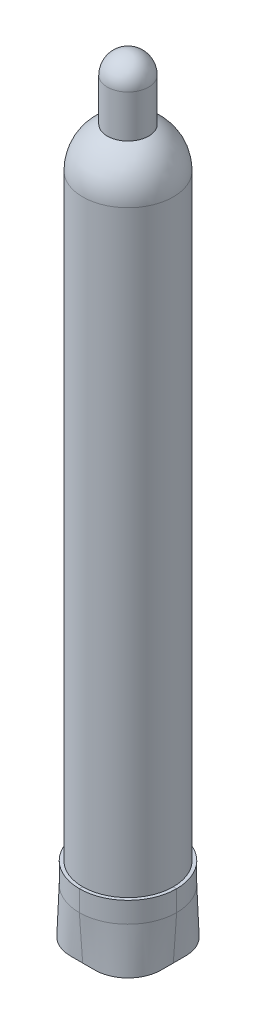
from build123d import *

# Parameters (mm, degrees)
EXTRUDE_1_DEPTH          = 50
PATTERN_CIRCULAR_2_COUNT = 4


with BuildPart() as part:
    # Эскиз1 → Повернуть1 (revolve)
    with BuildSketch(Plane.XY):
        with BuildLine():
            Line((109.5, 109.5), (109.5, 1602.582085836))
            ThreePointArc((109.5, 1602.582085836), (93.448515237, 1659.657693586), (50, 1700))
            Line((50, 1700), (50, 1802.582085836))
            ThreePointArc((50, 1802.582085836), (35.355339059, 1837.937424896), (0, 1852.582085836))
            Line((0, 1852.582085836), (0, 1843.582085836))
            ThreePointArc((0, 1843.582085836), (28.991378029, 1831.573463865), (41, 1802.582085836))
            Line((41, 1802.582085836), (41, 1694.338556998))
            ThreePointArc((41, 1694.338556998), (84.323039556, 1657.261835287), (100.5, 1602.582085836))
            Line((100.5, 1602.582085836), (100.5, 109.5))
            ThreePointArc((100.5, 109.5), (71.064231509, 38.435768491), (0, 9))
            Line((0, 9), (0, 0))
            ThreePointArc((0, 0), (77.42819254, 32.07180746), (109.5, 109.5))
        make_face()
    revolve(axis=Axis((0, -1697.886400438, 0), (0, 1, 0)))


with BuildPart() as body_2:
    # По траектории1: read off the stored shape, not the designer's step
    # По траектории1: loft between two sections, ruled curve by curve
    sweep_1_from = [
        Edge.make_bspline([(-109.5, 109.5, 0), (-109.493433422, 109.5, -0.910168025), (-109.480308312, 109.5, -2.729388887), (-109.354684179, 109.5, -5.972889138), (-109.070354228, 109.5, -10.09091356), (-108.5461644, 109.5, -14.68452027), (-107.774125544, 109.5, -19.55540512), (-106.877669566, 109.5, -23.971043834), (-105.839798954, 109.5, -28.163458896), (-104.865887775, 109.5, -31.574912227), (-103.473665348, 109.5, -35.950748157), (-101.649559756, 109.5, -40.883728987), (-99.233071788, 109.5, -46.399280964), (-97.008336197, 109.5, -50.861130938), (-94.635355215, 109.5, -55.154383025), (-92.240755866, 109.5, -59.074044109), (-88.4571369, 109.5, -64.693311466), (-83.695983566, 109.5, -70.819583859), (-76.987969909, 109.5, -78.058997048), (-70.234130613, 109.5, -84.188002557), (-63.755891418, 109.5, -89.11515306), (-58.746882418, 109.5, -92.449493446), (-54.49764908, 109.5, -95.014509627), (-50.531251362, 109.5, -97.180613295), (-45.597992341, 109.5, -99.609066967), (-40.404079053, 109.5, -101.841268541), (-35.212756467, 109.5, -103.719198527), (-31.323109565, 109.5, -104.941390476), (-27.552161282, 109.5, -106.00323483), (-23.607479605, 109.5, -106.958668933), (-18.812084881, 109.5, -107.906601335), (-14.303896069, 109.5, -108.597046997), (-9.321270503, 109.5, -109.138785516), (-5.389487063, 109.5, -109.389273408), (-2.144980996, 109.5, -109.487813496), (-0.715241188, 109.5, -109.495936426), (0, 109.5, -109.5)], [0, 0, 0, 0, 0.015603907, 0.031188696, 0.055656537, 0.086427193, 0.11063552, 0.140649137, 0.164324457, 0.185675756, 0.202477267, 0.244436193, 0.277531392, 0.307906958, 0.33185718, 0.363656198, 0.388602587, 0.451011123, 0.500000463, 0.562343923, 0.611398311, 0.643152284, 0.668143726, 0.698611393, 0.722469495, 0.764566972, 0.797523576, 0.818902887, 0.83567639, 0.865792294, 0.889365342, 0.920168946, 0.944344317, 0.975488442, 0.987737856, 1, 1, 1, 1], 3),
        Edge.make_bspline([(-117.5, 109.5, 0), (-117.492953747, 109.5, -0.97665655), (-117.478869876, 109.5, -2.928772996), (-117.344067348, 109.5, -6.409259588), (-117.038961521, 109.5, -10.828186078), (-116.476470106, 109.5, -15.757436629), (-115.648025729, 109.5, -20.984188197), (-114.68608084, 109.5, -25.722401442), (-113.572394957, 109.5, -30.221067397), (-112.527340763, 109.5, -33.881723345), (-111.033415045, 109.5, -38.577218971), (-109.076045031, 109.5, -43.870592901), (-106.482991001, 109.5, -49.789153172), (-104.095689809, 109.5, -54.57703699), (-101.549355955, 109.5, -59.183922639), (-98.979817338, 109.5, -63.389938392), (-94.919725306, 109.5, -69.419812731), (-89.810699432, 109.5, -75.993694541), (-82.612673091, 109.5, -83.761935996), (-75.3654713, 109.5, -90.338663626), (-68.413896202, 109.5, -95.625822318), (-63.03886867, 109.5, -99.203808533), (-58.479215178, 109.5, -101.95620708), (-54.223051303, 109.5, -104.280556415), (-48.929315027, 109.5, -106.886459794), (-43.355897666, 109.5, -109.281760647), (-37.785314963, 109.5, -111.296885073), (-33.611526742, 109.5, -112.608358852), (-29.565115269, 109.5, -113.747769613), (-25.332279119, 109.5, -114.772997212), (-20.186563452, 109.5, -115.790179787), (-15.349001972, 109.5, -116.531070552), (-10.002306208, 109.5, -117.112393034), (-5.78322773, 109.5, -117.381183926), (-2.30167145, 109.5, -117.486923303), (-0.767489421, 109.5, -117.495639592), (0, 109.5, -117.5)], [0, 0, 0, 0, 0.015603907, 0.031188696, 0.055656537, 0.086427193, 0.11063552, 0.140649137, 0.164324457, 0.185675756, 0.202477267, 0.244436193, 0.277531392, 0.307906958, 0.33185718, 0.363656198, 0.388602587, 0.451011123, 0.500000463, 0.562343923, 0.611398311, 0.643152284, 0.668143726, 0.698611393, 0.722469495, 0.764566972, 0.797523576, 0.818902887, 0.83567639, 0.865792294, 0.889365342, 0.920168946, 0.944344317, 0.975488442, 0.987737856, 1, 1, 1, 1], 3),
        Edge.make_line((0, 109.5, -117.5), (0, 109.5, -109.5)),
        Edge.make_line((-117.5, 109.5, 0), (-109.5, 109.5, 0)),
    ]
    sweep_1_to = [
        Edge.make_bspline([(-101.5, 0, 0), (-101.493913097, 0, -0.8436795), (-101.481746748, 0, -2.530004778), (-101.365301009, 0, -5.536518687), (-101.101746934, 0, -9.353641043), (-100.615858694, 0, -13.61160391), (-99.900225359, 0, -18.126622043), (-99.069258292, 0, -22.219686227), (-98.107202952, 0, -26.105850395), (-97.204434787, 0, -29.268101109), (-95.913915651, 0, -33.324277343), (-94.223074481, 0, -37.896865073), (-91.983152574, 0, -43.009408756), (-89.920982585, 0, -47.145224886), (-87.721354475, 0, -51.124843411), (-85.501694394, 0, -54.758149826), (-81.994548493, 0, -59.966810201), (-77.5812677, 0, -65.645473178), (-71.363266728, 0, -72.3560581), (-65.102789927, 0, -78.037341488), (-59.097886633, 0, -82.604483802), (-54.454896167, 0, -85.69517836), (-50.516082982, 0, -88.072812175), (-46.839451421, 0, -90.080670175), (-42.266669655, 0, -92.331674141), (-37.452260439, 0, -94.400776434), (-32.640197971, 0, -96.141511981), (-29.034692389, 0, -97.2744221), (-25.539207295, 0, -98.258700047), (-21.88268009, 0, -99.144340653), (-17.43760631, 0, -100.023022882), (-13.258790165, 0, -100.663023442), (-8.640234798, 0, -101.165177998), (-4.995746396, 0, -101.397362889), (-1.988290541, 0, -101.488703689), (-0.662992955, 0, -101.496233259), (0, 0, -101.5)], [0, 0, 0, 0, 0.015603907, 0.031188696, 0.055656537, 0.086427193, 0.11063552, 0.140649137, 0.164324457, 0.185675756, 0.202477267, 0.244436193, 0.277531392, 0.307906958, 0.33185718, 0.363656198, 0.388602587, 0.451011123, 0.500000463, 0.562343923, 0.611398311, 0.643152284, 0.668143726, 0.698611393, 0.722469495, 0.764566972, 0.797523576, 0.818902887, 0.83567639, 0.865792294, 0.889365342, 0.920168946, 0.944344317, 0.975488442, 0.987737856, 1, 1, 1, 1], 3),
        Edge.make_bspline([(-109.5, 0, 0), (-109.500001092, 0, -0.910168278), (-109.500003274, 0, -2.729389645), (-109.499983819, 0, -5.978936541), (-109.500111775, 0, -10.124469821), (-109.49951943, 0, -14.803377518), (-109.501498912, 0, -19.856614675), (-109.49348461, 0, -24.541567915), (-109.517820266, 0, -29.129024491), (-109.445620874, 0, -32.944742746), (-109.10022917, 0, -37.883779623), (-108.326137005, 0, -43.539272786), (-106.866675281, 0, -49.949543593), (-105.263601325, 0, -55.176962255), (-103.355957304, 0, -60.224902827), (-101.257254478, 0, -64.838353792), (-97.705454949, 0, -71.43452987), (-92.863734395, 0, -78.561761644), (-85.571604648, 0, -86.761282314), (-77.884085225, 0, -93.382449107), (-70.336904321, 0, -98.338951548), (-64.453103545, 0, -101.446345036), (-59.452387994, 0, -103.673062813), (-54.789292547, 0, -105.394403032), (-49.01439912, 0, -107.117688318), (-42.984710737, 0, -108.424216719), (-37.04701649, 0, -109.174329913), (-32.662243781, 0, -109.458999978), (-28.45135743, 0, -109.519036101), (-24.152228239, 0, -109.495244944), (-19.077608667, 0, -109.501549001), (-14.413700772, 0, -109.499649954), (-9.345637674, 0, -109.500114283), (-5.393220868, 0, -109.499987966), (-2.144981468, 0, -109.500001834), (-0.715241345, 0, -109.500000611), (0, 0, -109.5)], [0, 0, 0, 0, 0.015603907, 0.031188696, 0.055656537, 0.086427193, 0.11063552, 0.140649137, 0.164324457, 0.185675756, 0.202477267, 0.244436193, 0.277531392, 0.307906958, 0.33185718, 0.363656198, 0.388602587, 0.451011123, 0.500000463, 0.562343923, 0.611398311, 0.643152284, 0.668143726, 0.698611393, 0.722469495, 0.764566972, 0.797523576, 0.818902887, 0.83567639, 0.865792294, 0.889365342, 0.920168946, 0.944344317, 0.975488442, 0.987737856, 1, 1, 1, 1], 3),
        Edge.make_line((0, 0, -109.5), (0, 0, -101.5)),
        Edge.make_line((-109.5, 0, 0), (-101.5, 0, 0)),
    ]
    sweep_1 = Solid(Shell([*[Face.make_surface_from_curves(sweep_1_from[k], sweep_1_to[k]) for k in range(4)], Face(Wire(sweep_1_from)), Face(Wire(sweep_1_to))]))
    add(sweep_1)

    # Эскиз7 → Бобышка-Вытянуть1 (add)
    with BuildSketch(Plane(origin=(0, 109.5, 0), x_dir=(1, 0, 0), z_dir=(0, 1, 0))):
        with BuildLine():
            Line((-117.5, 0), (-109.5, 0))
            add(Edge.make_bspline(
                [(-109.5, 0), (-109.493433422, 0.910168025), (-109.480308312, 2.729388887), (-109.354684179, 5.972889138), (-109.070354228, 10.09091356), (-108.5461644, 14.68452027), (-107.774125544, 19.55540512), (-106.877669566, 23.971043834), (-105.839798954, 28.163458896), (-104.865887775, 31.574912227), (-103.473665348, 35.950748157), (-101.649559756, 40.883728987), (-99.233071788, 46.399280964), (-97.008336197, 50.861130938), (-94.635355215, 55.154383025), (-92.240755866, 59.074044109), (-88.4571369, 64.693311466), (-83.695983566, 70.819583859), (-76.987969909, 78.058997048), (-70.234130613, 84.188002557), (-63.755891418, 89.11515306), (-58.746882418, 92.449493446), (-54.49764908, 95.014509627), (-50.531251362, 97.180613295), (-45.597992341, 99.609066967), (-40.404079053, 101.841268541), (-35.212756467, 103.719198527), (-31.323109565, 104.941390476), (-27.552161282, 106.00323483), (-23.607479605, 106.958668933), (-18.812084881, 107.906601335), (-14.303896069, 108.597046997), (-9.321270503, 109.138785516), (-5.389487063, 109.389273408), (-2.144980996, 109.487813496), (-0.715241188, 109.495936426), (0, 109.5)],
                knots=[0, 0, 0, 0, 0.015603907, 0.031188696, 0.055656537, 0.086427193, 0.11063552, 0.140649137, 0.164324457, 0.185675756, 0.202477267, 0.244436193, 0.277531392, 0.307906958, 0.33185718, 0.363656198, 0.388602587, 0.451011123, 0.500000463, 0.562343923, 0.611398311, 0.643152284, 0.668143726, 0.698611393, 0.722469495, 0.764566972, 0.797523576, 0.818902887, 0.83567639, 0.865792294, 0.889365342, 0.920168946, 0.944344317, 0.975488442, 0.987737856, 1, 1, 1, 1], degree=3))
            Line((0, 109.5), (0, 117.5))
            add(Edge.make_bspline(
                [(0, 117.5), (-0.767489421, 117.495639592), (-2.30167145, 117.486923303), (-5.78322773, 117.381183926), (-10.002306208, 117.112393034), (-15.349001972, 116.531070552), (-20.186563452, 115.790179787), (-25.332279119, 114.772997212), (-29.565115269, 113.747769613), (-33.611526742, 112.608358852), (-37.785314963, 111.296885073), (-43.355897666, 109.281760647), (-48.929315027, 106.886459794), (-54.223051303, 104.280556415), (-58.479215178, 101.95620708), (-63.03886867, 99.203808533), (-68.413896202, 95.625822318), (-75.3654713, 90.338663626), (-82.612673091, 83.761935996), (-89.810699432, 75.993694541), (-94.919725306, 69.419812731), (-98.979817338, 63.389938392), (-101.549355955, 59.183922639), (-104.095689809, 54.57703699), (-106.482991001, 49.789153172), (-109.076045031, 43.870592901), (-111.033415045, 38.577218971), (-112.527340763, 33.881723345), (-113.572394957, 30.221067397), (-114.68608084, 25.722401442), (-115.648025729, 20.984188197), (-116.476470106, 15.757436629), (-117.038961521, 10.828186078), (-117.344067348, 6.409259588), (-117.478869876, 2.928772996), (-117.492953747, 0.97665655), (-117.5, 0)],
                knots=[0, 0, 0, 0, 0.012262144, 0.024511558, 0.055655683, 0.079831054, 0.110634658, 0.134207706, 0.16432361, 0.181097113, 0.202476424, 0.235433028, 0.277530505, 0.301388607, 0.331856274, 0.356847716, 0.388601689, 0.437656077, 0.499999537, 0.548988877, 0.611397413, 0.636343802, 0.66814282, 0.692093042, 0.722468608, 0.755563807, 0.797522733, 0.814324244, 0.835675543, 0.859350863, 0.88936448, 0.913572807, 0.944343463, 0.968811304, 0.984396093, 1, 1, 1, 1], degree=3))
        make_face()
    extrude(amount=EXTRUDE_1_DEPTH)


with BuildPart() as pattern_circular_2_1:
    # Круговой массив2: pattern copy
    add(body_2.part.rotate(Axis((0, 50, 0), (0, -1, 0)), 1 * 360 / PATTERN_CIRCULAR_2_COUNT))


with BuildPart() as pattern_circular_2_2:
    # Круговой массив2: pattern copy
    add(body_2.part.rotate(Axis((0, 50, 0), (0, -1, 0)), 2 * 360 / PATTERN_CIRCULAR_2_COUNT))


with BuildPart() as pattern_circular_2_3:
    # Круговой массив2: pattern copy
    add(body_2.part.rotate(Axis((0, 50, 0), (0, -1, 0)), 3 * 360 / PATTERN_CIRCULAR_2_COUNT))


solid = Compound([part.part, body_2.part, pattern_circular_2_1.part, pattern_circular_2_2.part, pattern_circular_2_3.part])
